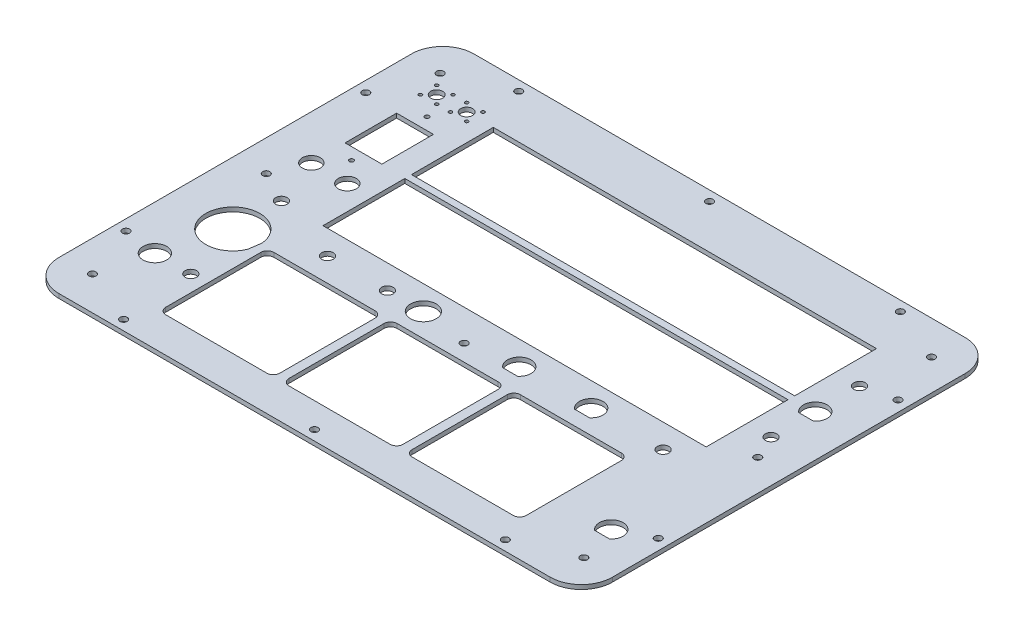
from build123d import *

# Parameters (mm, degrees)
SKETCH1_W             = 293.2938
SKETCH1_H             = 219.8624
BOSS_EXTRUDE1_DEPTH   = 2.286
FILLET1_R             = 16.51
SKETCH13_W            = 202.9968
SKETCH13_H            = 43.3324
CUT_EXTRUDE4_DEPTH    = 395.829550743
SKETCH10_R            = 3.175
CUT_EXTRUDE2_DEPTH    = 184.290501142
F_2_56_TAPPED_HOLE1_D = 1.778
SKETCH3_R             = 3.048
SKETCH3_R_2           = 6.8
CUT_EXTRUDE5_DEPTH    = 184.290501142
SKETCH9_R             = 4.7625
SKETCH9_R_2           = 3.048
SKETCH9_R_3           = 6.2484
SKETCH9_W             = 19.5
SKETCH9_H             = 27.3
CUT_EXTRUDE3_DEPTH    = 184.290501142
F_4_40_TAPPED_HOLE1_D = 2.2606
F_6_CLEARANCE_HOLE1_D = 3.7973
F_6_CLEARANCE_HOLE2_D = 3.7973
CUT_EXTRUDE6_DEPTH    = 395.829550743
LPATTERN1_COUNT       = 2
LPATTERN1_PITCH       = 15.875


with BuildPart() as part:
    # Sketch1 → Boss-Extrude1 (new body)
    with BuildSketch(Plane(origin=(0, 0, 0), x_dir=(1, 0, 0), z_dir=(0, 1, 0))):
        Rectangle(SKETCH1_W, SKETCH1_H)
    extrude(amount=BOSS_EXTRUDE1_DEPTH)

    # Fillet1
    fillet1_edges = [part.edges().sort_by_distance(p)[0] for p in [
        (-146.6469, 1.143, -109.9312),
        (146.6469, 1.143, -109.9312),
        (-146.6469, 1.143, 109.9312),
        (146.6469, 1.143, 109.9312),
    ]]
    fillet(fillet1_edges, radius=FILLET1_R)

    # Sketch13 → Cut-Extrude4 (cut, through all)
    with BuildSketch(Plane(origin=(0, 2.286, -256.647352379), x_dir=(1, 0, 0), z_dir=(0, 1, 0))):
        with Locations((10.2235, -196.957352379)):
            Rectangle(SKETCH13_W, SKETCH13_H)
        with Locations((10.2235, -243.829848144)):
            Rectangle(SKETCH13_W, SKETCH13_H)
    extrude(amount=-CUT_EXTRUDE4_DEPTH, mode=Mode.SUBTRACT)

    # Sketch10 → Cut-Extrude2 (cut, through all)
    with BuildSketch(Plane(origin=(0, 2.286, 0), x_dir=(1, 0, 0), z_dir=(0, 1, 0))):
        with Locations((-121.2469, 81.3562)):
            Circle(SKETCH10_R)
    cut_extrude2 = extrude(amount=-CUT_EXTRUDE2_DEPTH, mode=Mode.SUBTRACT)

    # #2-56 Tapped Hole1 (through all)
    with Locations(Plane(origin=(0, 2.286, 0), x_dir=(1, 0, 0), z_dir=(0, 1, 0))):
        with Locations((-125.5649, 85.6742), (-116.9289, 77.0382), (-116.9289, 85.6742), (-125.5649, 77.0382)):
            f_2_56_tapped_hole1 = Hole(F_2_56_TAPPED_HOLE1_D / 2)

    # Sketch3 → Cut-Extrude5 (cut, through all)
    with BuildSketch(Plane(origin=(0, 2.286, 0), x_dir=(1, 0, 0), z_dir=(0, 1, 0))):
        with Locations((124.4219, 59.69)):
            Circle(SKETCH3_R)
        with Locations((124.4219, 12.817504235)):
            Circle(SKETCH3_R)
        with Locations((-76.2, -21.548695765)):
            Circle(SKETCH3_R)
        with Locations((-44.45, -21.548695765)):
            Circle(SKETCH3_R)
        with Locations((-25.4, -21.548695765)):
            Circle(SKETCH3_R_2)
        with Locations((101.6, -21.548695765)):
            Circle(SKETCH3_R)
        with BuildLine():
            Line((59.56218073, -26.400095765), (67.43781927, -26.400095765))
            ThreePointArc((67.43781927, -26.400095765), (63.5, -15.300295765), (59.56218073, -26.400095765))
        make_face()
        with BuildLine():
            Line((21.46218073, -26.400095765), (29.33781927, -26.400095765))
            ThreePointArc((29.33781927, -26.400095765), (25.4, -15.300295765), (21.46218073, -26.400095765))
        make_face()
        with BuildLine():
            Line((120.48408073, 31.402352117), (128.35971927, 31.402352117))
            ThreePointArc((128.35971927, 31.402352117), (124.4219, 42.502152117), (120.48408073, 31.402352117))
        make_face()
        with BuildLine():
            Line((120.48408073, -76.6826), (128.35971927, -76.6826))
            ThreePointArc((128.35971927, -76.6826), (124.4219, -65.5828), (120.48408073, -76.6826))
        make_face()
    extrude(amount=-CUT_EXTRUDE5_DEPTH, mode=Mode.SUBTRACT)

    # Sketch9 → Cut-Extrude3 (cut, through all)
    with BuildSketch(Plane(origin=(0, 2.286, 0), x_dir=(1, 0, 0), z_dir=(0, 1, 0))):
        with Locations((-123.19, 16.891)):
            Circle(SKETCH9_R)
        with Locations((-104.14, 16.891)):
            Circle(SKETCH9_R)
        with Locations((-113.665, -8.509)):
            Circle(SKETCH9_R_2)
        with Locations((-123.19, -65.998695765)):
            Circle(SKETCH9_R_3)
        with Locations((-104.14, -65.998695765)):
            Circle(SKETCH9_R_2)
        with Locations((-113.665, 48.641)):
            Rectangle(SKETCH9_W, SKETCH9_H)
        with BuildLine():
            Line((-99.436423365, -32.952446097), (-100.389836734, -39.530996069))
            ThreePointArc((-100.389836734, -39.530996069), (-127.804775708, -32.199452203), (-99.436423365, -32.952446097))
        make_face()
    extrude(amount=-CUT_EXTRUDE3_DEPTH, mode=Mode.SUBTRACT)

    # #4-40 Tapped Hole1 (through all)
    with Locations(Plane(origin=(0, 2.286, 0), x_dir=(1, 0, 0), z_dir=(0, 1, 0))):
        with Locations((-113.665, 28.641), (-113.665, 68.641)):
            Hole(F_4_40_TAPPED_HOLE1_D / 2)

    # #6 Clearance Hole1 (through all)
    with Locations(Plane(origin=(0, 2.286, -256.647352379), x_dir=(1, 0, 0), z_dir=(0, 1, 0))):
        with Locations((0.013910703, -152.000563082), (-101.078089297, -152.000563082), (101.105910703, -152.000563082), (140.983910703, -193.148563082), (140.983910703, -320.148563082), (101.105910703, -361.296563082), (0.013910703, -361.296563082), (-101.078089297, -361.296563082), (-140.956089297, -320.148563082), (-140.956089297, -193.148563082)):
            Hole(F_6_CLEARANCE_HOLE1_D / 2)

    # #6 Clearance Hole2 (through all)
    with Locations(Plane(origin=(0, 2.286, 0), x_dir=(1, 0, 0), z_dir=(0, 1, 0))):
        with Locations((-130.175, 0), (-130.175, -92.075), (-130.175, 92.075), (130.175, 92.075), (130.175, -92.075), (130.175, 0), (0, -25.4)):
            Hole(F_6_CLEARANCE_HOLE2_D / 2)

    # Sketch20 → Cut-Extrude6 (cut, through all)
    with BuildSketch(Plane(origin=(0, 2.286, -256.647352379), x_dir=(1, 0, 0), z_dir=(0, 1, 0))):
        with BuildLine():
            Line((-95.504, -294.177063082), (-95.504, -344.596063082))
            ThreePointArc((-95.504, -344.596063082), (-94.499669153, -347.020732234), (-92.075, -348.025063082))
            Line((-92.075, -348.025063082), (-38.481, -348.025063082))
            ThreePointArc((-38.481, -348.025063082), (-36.056330847, -347.020732234), (-35.052, -344.596063082))
            Line((-35.052, -344.596063082), (-35.052, -294.177063082))
            ThreePointArc((-35.052, -294.177063082), (-36.056330847, -291.752393929), (-38.481, -290.748063082))
            Line((-38.481, -290.748063082), (-92.075, -290.748063082))
            ThreePointArc((-92.075, -290.748063082), (-94.499669153, -291.752393929), (-95.504, -294.177063082))
        make_face()
        with BuildLine():
            Line((-30.226, -294.177063082), (-30.226, -344.596063082))
            ThreePointArc((-30.226, -344.596063082), (-29.221669153, -347.020732234), (-26.797, -348.025063082))
            Line((-26.797, -348.025063082), (26.797, -348.025063082))
            ThreePointArc((26.797, -348.025063082), (29.221669153, -347.020732234), (30.226, -344.596063082))
            Line((30.226, -344.596063082), (30.226, -294.177063082))
            ThreePointArc((30.226, -294.177063082), (29.221669153, -291.752393929), (26.797, -290.748063082))
            Line((26.797, -290.748063082), (-26.797, -290.748063082))
            ThreePointArc((-26.797, -290.748063082), (-29.221669153, -291.752393929), (-30.226, -294.177063082))
        make_face()
        with BuildLine():
            Line((35.052, -294.177063082), (35.052, -344.596063082))
            ThreePointArc((35.052, -344.596063082), (36.056330847, -347.020732234), (38.481, -348.025063082))
            Line((38.481, -348.025063082), (92.075, -348.025063082))
            ThreePointArc((92.075, -348.025063082), (94.499669153, -347.020732234), (95.504, -344.596063082))
            Line((95.504, -344.596063082), (95.504, -294.177063082))
            ThreePointArc((95.504, -294.177063082), (94.499669153, -291.752393929), (92.075, -290.748063082))
            Line((92.075, -290.748063082), (38.481, -290.748063082))
            ThreePointArc((38.481, -290.748063082), (36.056330847, -291.752393929), (35.052, -294.177063082))
        make_face()
    extrude(amount=-CUT_EXTRUDE6_DEPTH, mode=Mode.SUBTRACT)

    # LPattern1: Cut-Extrude2, #2-56 Tapped Hole1 ×2
    with Locations(*[(i * LPATTERN1_PITCH, 0, 0) for i in range(1, LPATTERN1_COUNT)]):
        add(cut_extrude2, mode=Mode.SUBTRACT)
        add(f_2_56_tapped_hole1, mode=Mode.SUBTRACT)


solid = part.part
